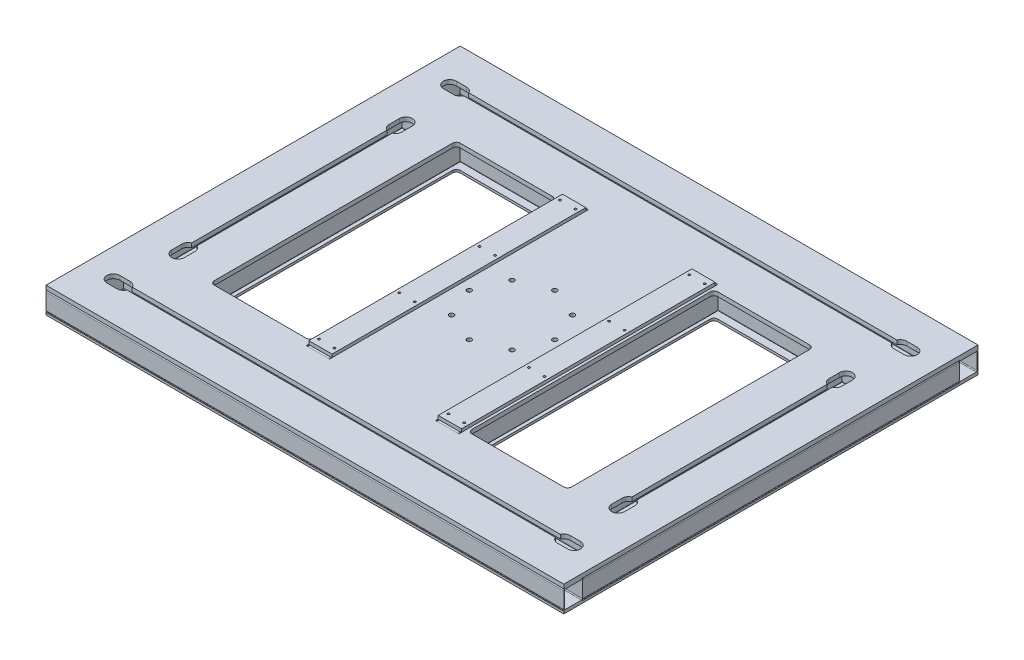
from build123d import *

# Parameters (mm, degrees)
SKETCH_1_W               = 2000
SKETCH_1_H               = 1600
EXTRUDE_1_DEPTH          = 9
CUT_EXTRUDE_1_DEPTH      = 1281.656472283
CUT_EXTRUDE_1_DEPTH_BACK = 1281.656472283
CUT_EXTRUDE_2_DEPTH      = 1281.656472283
CUT_EXTRUDE_2_DEPTH_BACK = 1281.656472283
CUT_EXTRUDE_3_DEPTH      = 1281.656472283
CUT_EXTRUDE_3_DEPTH_BACK = 1281.656472283
EXTRUDE_2_DEPTH          = 1000
EXTRUDE_2_DEPTH_BACK     = 1000
EXTRUDE_3_DEPTH          = 925
EXTRUDE_3_DEPTH_BACK     = 925
EXTRUDE_4_DEPTH          = 725
EXTRUDE_4_DEPTH_BACK     = 725
EXTRUDE_5_DEPTH          = 500
EXTRUDE_5_DEPTH_BACK     = 500
SKETCH_10_W              = 2000
SKETCH_10_H              = 1600
EXTRUDE_6_DEPTH          = 16
CUT_EXTRUDE_4_DEPTH      = 1285.523257867
CUT_EXTRUDE_4_DEPTH_BACK = 1285.523257867
SKETCH_13_W              = 90
SKETCH_13_H              = 1000
CUT_EXTRUDE_5_DEPTH      = 16
EXTRUDE_7_DEPTH          = 500
EXTRUDE_7_DEPTH_BACK     = 500
SKETCH_16_W              = 90
SKETCH_16_H              = 980
EXTRUDE_8_DEPTH          = 13
SKETCH_17_W              = 90
SKETCH_17_H              = 980
EXTRUDE_9_DEPTH          = 13
CUT_EXTRUDE_6_DEPTH      = 16
CUT_EXTRUDE_7_DEPTH      = 16
CUT_EXTRUDE_8_DEPTH      = 1286.513127121
CUT_EXTRUDE_8_DEPTH_BACK = 1286.513127121
SKETCH_20_R              = 9
SKETCH_22_R              = 4.188
CUT_EXTRUDE_9_DEPTH      = 15.3


with BuildPart() as part:
    # ｽｹｯﾁ1 → ﾎﾞｽ - 押し出し1 (new body)
    with BuildSketch(Plane(origin=(0, 0, 0), x_dir=(1, 0, 0), z_dir=(0, 1, 0))):
        Rectangle(SKETCH_1_W, SKETCH_1_H)
    extrude(amount=EXTRUDE_1_DEPTH)

    # ｽｹｯﾁ2 → ｶｯﾄ - 押し出し1 (cut, two sides: drawn at the far end of the back side and taken through both)
    with BuildSketch(Plane(origin=(0, 0, 0), x_dir=(1, 0, 0), z_dir=(0, 1, 0)).offset(-CUT_EXTRUDE_1_DEPTH_BACK)):
        with BuildLine():
            Line((-675, -475), (-320, -475))
            ThreePointArc((-320, -475), (-309.393398282, -470.606601718), (-305, -460))
            Line((-305, -460), (-305, 460))
            ThreePointArc((-305, 460), (-309.393398282, 470.606601718), (-320, 475))
            Line((-320, 475), (-675, 475))
            ThreePointArc((-675, 475), (-685.606601718, 470.606601718), (-690, 460))
            Line((-690, 460), (-690, -460))
            ThreePointArc((-690, -460), (-685.606601718, -470.606601718), (-675, -475))
        make_face()
        with BuildLine():
            Line((320, -475), (675, -475))
            ThreePointArc((675, -475), (685.606601718, -470.606601718), (690, -460))
            Line((690, -460), (690, 460))
            ThreePointArc((690, 460), (685.606601718, 470.606601718), (675, 475))
            Line((675, 475), (320, 475))
            ThreePointArc((320, 475), (309.393398282, 470.606601718), (305, 460))
            Line((305, 460), (305, -460))
            ThreePointArc((305, -460), (309.393398282, -470.606601718), (320, -475))
        make_face()
    extrude(amount=CUT_EXTRUDE_1_DEPTH + CUT_EXTRUDE_1_DEPTH_BACK, mode=Mode.SUBTRACT)

    # ｽｹｯﾁ3 → ｶｯﾄ - 押し出し2 (cut, two sides: drawn at the far end of the back side and taken through both)
    with BuildSketch(Plane(origin=(0, 0, 0), x_dir=(1, 0, 0), z_dir=(0, 1, 0)).offset(-CUT_EXTRUDE_2_DEPTH_BACK)):
        with BuildLine():
            Line((-885, -475), (-815, -475))
            ThreePointArc((-815, -475), (-804.393398282, -470.606601718), (-800, -460))
            Line((-800, -460), (-800, 460))
            ThreePointArc((-800, 460), (-804.393398282, 470.606601718), (-815, 475))
            Line((-815, 475), (-885, 475))
            ThreePointArc((-885, 475), (-895.606601718, 470.606601718), (-900, 460))
            Line((-900, 460), (-900, -460))
            ThreePointArc((-900, -460), (-895.606601718, -470.606601718), (-885, -475))
        make_face()
        with BuildLine():
            Line((815, -475), (885, -475))
            ThreePointArc((885, -475), (895.606601718, -470.606601718), (900, -460))
            Line((900, -460), (900, 460))
            ThreePointArc((900, 460), (895.606601718, 470.606601718), (885, 475))
            Line((885, 475), (815, 475))
            ThreePointArc((815, 475), (804.393398282, 470.606601718), (800, 460))
            Line((800, 460), (800, -460))
            ThreePointArc((800, -460), (804.393398282, -470.606601718), (815, -475))
        make_face()
    extrude(amount=CUT_EXTRUDE_2_DEPTH + CUT_EXTRUDE_2_DEPTH_BACK, mode=Mode.SUBTRACT)

    # ｽｹｯﾁ4 → ｶｯﾄ - 押し出し3 (cut, two sides: drawn at the far end of the back side and taken through both)
    with BuildSketch(Plane(origin=(0, 0, 0), x_dir=(1, 0, 0), z_dir=(0, 1, 0)).offset(-CUT_EXTRUDE_3_DEPTH_BACK)):
        with BuildLine():
            Line((-885, -700), (885, -700))
            ThreePointArc((885, -700), (895.606601718, -695.606601718), (900, -685))
            Line((900, -685), (900, -615))
            ThreePointArc((900, -615), (895.606601718, -604.393398282), (885, -600))
            Line((885, -600), (-885, -600))
            ThreePointArc((-885, -600), (-895.606601718, -604.393398282), (-900, -615))
            Line((-900, -615), (-900, -685))
            ThreePointArc((-900, -685), (-895.606601718, -695.606601718), (-885, -700))
        make_face()
        with BuildLine():
            Line((-885, 600), (885, 600))
            ThreePointArc((885, 600), (895.606601718, 604.393398282), (900, 615))
            Line((900, 615), (900, 685))
            ThreePointArc((900, 685), (895.606601718, 695.606601718), (885, 700))
            Line((885, 700), (-885, 700))
            ThreePointArc((-885, 700), (-895.606601718, 695.606601718), (-900, 685))
            Line((-900, 685), (-900, 615))
            ThreePointArc((-900, 615), (-895.606601718, 604.393398282), (-885, 600))
        make_face()
    extrude(amount=CUT_EXTRUDE_3_DEPTH + CUT_EXTRUDE_3_DEPTH_BACK, mode=Mode.SUBTRACT)

    # ｽｹｯﾁ5 → ﾎﾞｽ - 押し出し2 (add, two sides: drawn at the far end of the back side and taken through both)
    # profile 1 of 2: a face of its own
    with BuildSketch(Plane(origin=(0, 0, 0), x_dir=(0, 0, -1), z_dir=(1, 0, 0)).offset(-EXTRUDE_2_DEPTH_BACK)):
        with BuildLine():
            Line((-793.6, 9), (-731.4, 9))
            ThreePointArc((-731.4, 9), (-726.8745166, 10.8745166), (-725, 15.4))
            Line((-725, 15.4), (-725, 77.6))
            ThreePointArc((-725, 77.6), (-726.8745166, 82.1254834), (-731.4, 84))
            Line((-731.4, 84), (-793.6, 84))
            ThreePointArc((-793.6, 84), (-798.1254834, 82.1254834), (-800, 77.6))
            Line((-800, 77.6), (-800, 15.4))
            ThreePointArc((-800, 15.4), (-798.1254834, 10.8745166), (-793.6, 9))
        make_face()
        with BuildLine():
            Line((-793.6, 12.2), (-731.4, 12.2))
            ThreePointArc((-731.4, 12.2), (-729.1372583, 13.1372583), (-728.2, 15.4))
            Line((-728.2, 15.4), (-728.2, 77.6))
            ThreePointArc((-728.2, 77.6), (-729.1372583, 79.8627417), (-731.4, 80.8))
            Line((-731.4, 80.8), (-793.6, 80.8))
            ThreePointArc((-793.6, 80.8), (-795.8627417, 79.8627417), (-796.8, 77.6))
            Line((-796.8, 77.6), (-796.8, 15.4))
            ThreePointArc((-796.8, 15.4), (-795.8627417, 13.1372583), (-793.6, 12.2))
        make_face(mode=Mode.SUBTRACT)
    # profile 2 of 2: a face of its own
    with BuildSketch(Plane(origin=(0, 0, 0), x_dir=(0, 0, -1), z_dir=(1, 0, 0)).offset(-EXTRUDE_2_DEPTH_BACK)):
        with BuildLine():
            Line((731.4, 9), (793.6, 9))
            ThreePointArc((793.6, 9), (798.1254834, 10.8745166), (800, 15.4))
            Line((800, 15.4), (800, 77.6))
            ThreePointArc((800, 77.6), (798.1254834, 82.1254834), (793.6, 84))
            Line((793.6, 84), (731.4, 84))
            ThreePointArc((731.4, 84), (726.8745166, 82.1254834), (725, 77.6))
            Line((725, 77.6), (725, 15.4))
            ThreePointArc((725, 15.4), (726.8745166, 10.8745166), (731.4, 9))
        make_face()
        with BuildLine():
            Line((731.4, 12.2), (793.6, 12.2))
            ThreePointArc((793.6, 12.2), (795.8627417, 13.1372583), (796.8, 15.4))
            Line((796.8, 15.4), (796.8, 77.6))
            ThreePointArc((796.8, 77.6), (795.8627417, 79.8627417), (793.6, 80.8))
            Line((793.6, 80.8), (731.4, 80.8))
            ThreePointArc((731.4, 80.8), (729.1372583, 79.8627417), (728.2, 77.6))
            Line((728.2, 77.6), (728.2, 15.4))
            ThreePointArc((728.2, 15.4), (729.1372583, 13.1372583), (731.4, 12.2))
        make_face(mode=Mode.SUBTRACT)
    extrude(amount=EXTRUDE_2_DEPTH + EXTRUDE_2_DEPTH_BACK)

    # ｽｹｯﾁ6 → ﾎﾞｽ - 押し出し3 (add, two sides: drawn at the far end of the back side and taken through both)
    # profile 1 of 2: a face of its own
    with BuildSketch(Plane(origin=(0, 0, 0), x_dir=(0, 0, -1), z_dir=(1, 0, 0)).offset(-EXTRUDE_3_DEPTH_BACK)):
        with BuildLine():
            Line((-568.6, 9), (-506.4, 9))
            ThreePointArc((-506.4, 9), (-501.8745166, 10.8745166), (-500, 15.4))
            Line((-500, 15.4), (-500, 77.6))
            ThreePointArc((-500, 77.6), (-501.8745166, 82.1254834), (-506.4, 84))
            Line((-506.4, 84), (-568.6, 84))
            ThreePointArc((-568.6, 84), (-573.1254834, 82.1254834), (-575, 77.6))
            Line((-575, 77.6), (-575, 15.4))
            ThreePointArc((-575, 15.4), (-573.1254834, 10.8745166), (-568.6, 9))
        make_face()
        with BuildLine():
            Line((-568.6, 12.2), (-506.4, 12.2))
            ThreePointArc((-506.4, 12.2), (-504.1372583, 13.1372583), (-503.2, 15.4))
            Line((-503.2, 15.4), (-503.2, 77.6))
            ThreePointArc((-503.2, 77.6), (-504.1372583, 79.8627417), (-506.4, 80.8))
            Line((-506.4, 80.8), (-568.6, 80.8))
            ThreePointArc((-568.6, 80.8), (-570.8627417, 79.8627417), (-571.8, 77.6))
            Line((-571.8, 77.6), (-571.8, 15.4))
            ThreePointArc((-571.8, 15.4), (-570.8627417, 13.1372583), (-568.6, 12.2))
        make_face(mode=Mode.SUBTRACT)
    # profile 2 of 2: a face of its own
    with BuildSketch(Plane(origin=(0, 0, 0), x_dir=(0, 0, -1), z_dir=(1, 0, 0)).offset(-EXTRUDE_3_DEPTH_BACK)):
        with BuildLine():
            Line((506.4, 9), (568.6, 9))
            ThreePointArc((568.6, 9), (573.1254834, 10.8745166), (575, 15.4))
            Line((575, 15.4), (575, 77.6))
            ThreePointArc((575, 77.6), (573.1254834, 82.1254834), (568.6, 84))
            Line((568.6, 84), (506.4, 84))
            ThreePointArc((506.4, 84), (501.8745166, 82.1254834), (500, 77.6))
            Line((500, 77.6), (500, 15.4))
            ThreePointArc((500, 15.4), (501.8745166, 10.8745166), (506.4, 9))
        make_face()
        with BuildLine():
            Line((506.4, 12.2), (568.6, 12.2))
            ThreePointArc((568.6, 12.2), (570.8627417, 13.1372583), (571.8, 15.4))
            Line((571.8, 15.4), (571.8, 77.6))
            ThreePointArc((571.8, 77.6), (570.8627417, 79.8627417), (568.6, 80.8))
            Line((568.6, 80.8), (506.4, 80.8))
            ThreePointArc((506.4, 80.8), (504.1372583, 79.8627417), (503.2, 77.6))
            Line((503.2, 77.6), (503.2, 15.4))
            ThreePointArc((503.2, 15.4), (504.1372583, 13.1372583), (506.4, 12.2))
        make_face(mode=Mode.SUBTRACT)
    extrude(amount=EXTRUDE_3_DEPTH + EXTRUDE_3_DEPTH_BACK)

    # ｽｹｯﾁ7 → ﾎﾞｽ - 押し出し4 (add, two sides: drawn at the far end of the back side and taken through both)
    # profile 1 of 2: a face of its own
    with BuildSketch(Plane.XY.offset(-EXTRUDE_4_DEPTH_BACK)):
        with BuildLine():
            Line((-993.6, 9), (-931.4, 9))
            ThreePointArc((-931.4, 9), (-926.8745166, 10.8745166), (-925, 15.4))
            Line((-925, 15.4), (-925, 77.6))
            ThreePointArc((-925, 77.6), (-926.8745166, 82.1254834), (-931.4, 84))
            Line((-931.4, 84), (-993.6, 84))
            ThreePointArc((-993.6, 84), (-998.1254834, 82.1254834), (-1000, 77.6))
            Line((-1000, 77.6), (-1000, 15.4))
            ThreePointArc((-1000, 15.4), (-998.1254834, 10.8745166), (-993.6, 9))
        make_face()
        with BuildLine():
            Line((-993.6, 12.2), (-931.4, 12.2))
            ThreePointArc((-931.4, 12.2), (-929.1372583, 13.1372583), (-928.2, 15.4))
            Line((-928.2, 15.4), (-928.2, 77.6))
            ThreePointArc((-928.2, 77.6), (-929.1372583, 79.8627417), (-931.4, 80.8))
            Line((-931.4, 80.8), (-993.6, 80.8))
            ThreePointArc((-993.6, 80.8), (-995.8627417, 79.8627417), (-996.8, 77.6))
            Line((-996.8, 77.6), (-996.8, 15.4))
            ThreePointArc((-996.8, 15.4), (-995.8627417, 13.1372583), (-993.6, 12.2))
        make_face(mode=Mode.SUBTRACT)
    # profile 2 of 2: a face of its own
    with BuildSketch(Plane.XY.offset(-EXTRUDE_4_DEPTH_BACK)):
        with BuildLine():
            Line((931.4, 9), (993.6, 9))
            ThreePointArc((993.6, 9), (998.1254834, 10.8745166), (1000, 15.4))
            Line((1000, 15.4), (1000, 77.6))
            ThreePointArc((1000, 77.6), (998.1254834, 82.1254834), (993.6, 84))
            Line((993.6, 84), (931.4, 84))
            ThreePointArc((931.4, 84), (926.8745166, 82.1254834), (925, 77.6))
            Line((925, 77.6), (925, 15.4))
            ThreePointArc((925, 15.4), (926.8745166, 10.8745166), (931.4, 9))
        make_face()
        with BuildLine():
            Line((931.4, 12.2), (993.6, 12.2))
            ThreePointArc((993.6, 12.2), (995.8627417, 13.1372583), (996.8, 15.4))
            Line((996.8, 15.4), (996.8, 77.6))
            ThreePointArc((996.8, 77.6), (995.8627417, 79.8627417), (993.6, 80.8))
            Line((993.6, 80.8), (931.4, 80.8))
            ThreePointArc((931.4, 80.8), (929.1372583, 79.8627417), (928.2, 77.6))
            Line((928.2, 77.6), (928.2, 15.4))
            ThreePointArc((928.2, 15.4), (929.1372583, 13.1372583), (931.4, 12.2))
        make_face(mode=Mode.SUBTRACT)
    extrude(amount=EXTRUDE_4_DEPTH + EXTRUDE_4_DEPTH_BACK)

    # ｽｹｯﾁ8 → ﾎﾞｽ - 押し出し5 (add, two sides: drawn at the far end of the back side and taken through both)
    # profile 1 of 2: a face of its own
    with BuildSketch(Plane.XY.offset(-EXTRUDE_5_DEPTH_BACK)):
        with BuildLine():
            Line((-768.6, 9), (-706.4, 9))
            ThreePointArc((-706.4, 9), (-701.8745166, 10.8745166), (-700, 15.4))
            Line((-700, 15.4), (-700, 77.6))
            ThreePointArc((-700, 77.6), (-701.8745166, 82.1254834), (-706.4, 84))
            Line((-706.4, 84), (-768.6, 84))
            ThreePointArc((-768.6, 84), (-773.1254834, 82.1254834), (-775, 77.6))
            Line((-775, 77.6), (-775, 15.4))
            ThreePointArc((-775, 15.4), (-773.1254834, 10.8745166), (-768.6, 9))
        make_face()
        with BuildLine():
            Line((-768.6, 12.2), (-706.4, 12.2))
            ThreePointArc((-706.4, 12.2), (-704.1372583, 13.1372583), (-703.2, 15.4))
            Line((-703.2, 15.4), (-703.2, 77.6))
            ThreePointArc((-703.2, 77.6), (-704.1372583, 79.8627417), (-706.4, 80.8))
            Line((-706.4, 80.8), (-768.6, 80.8))
            ThreePointArc((-768.6, 80.8), (-770.8627417, 79.8627417), (-771.8, 77.6))
            Line((-771.8, 77.6), (-771.8, 15.4))
            ThreePointArc((-771.8, 15.4), (-770.8627417, 13.1372583), (-768.6, 12.2))
        make_face(mode=Mode.SUBTRACT)
    # profile 2 of 2: a face of its own
    with BuildSketch(Plane.XY.offset(-EXTRUDE_5_DEPTH_BACK)):
        with BuildLine():
            Line((706.4, 9), (768.6, 9))
            ThreePointArc((768.6, 9), (773.1254834, 10.8745166), (775, 15.4))
            Line((775, 15.4), (775, 77.6))
            ThreePointArc((775, 77.6), (773.1254834, 82.1254834), (768.6, 84))
            Line((768.6, 84), (706.4, 84))
            ThreePointArc((706.4, 84), (701.8745166, 82.1254834), (700, 77.6))
            Line((700, 77.6), (700, 15.4))
            ThreePointArc((700, 15.4), (701.8745166, 10.8745166), (706.4, 9))
        make_face()
        with BuildLine():
            Line((706.4, 12.2), (768.6, 12.2))
            ThreePointArc((768.6, 12.2), (770.8627417, 13.1372583), (771.8, 15.4))
            Line((771.8, 15.4), (771.8, 77.6))
            ThreePointArc((771.8, 77.6), (770.8627417, 79.8627417), (768.6, 80.8))
            Line((768.6, 80.8), (706.4, 80.8))
            ThreePointArc((706.4, 80.8), (704.1372583, 79.8627417), (703.2, 77.6))
            Line((703.2, 77.6), (703.2, 15.4))
            ThreePointArc((703.2, 15.4), (704.1372583, 13.1372583), (706.4, 12.2))
        make_face(mode=Mode.SUBTRACT)
    extrude(amount=EXTRUDE_5_DEPTH + EXTRUDE_5_DEPTH_BACK)

    # ｽｹｯﾁ10 → ﾎﾞｽ - 押し出し6 (add)
    with BuildSketch(Plane(origin=(0, 84, 0), x_dir=(1, 0, 0), z_dir=(0, 1, 0))):
        Rectangle(SKETCH_10_W, SKETCH_10_H)
    extrude(amount=EXTRUDE_6_DEPTH)

    # ｽｹｯﾁ11 → ｶｯﾄ - 押し出し4 (cut, two sides: drawn at the far end of the back side and taken through both)
    with BuildSketch(Plane(origin=(0, 0, 0), x_dir=(1, 0, 0), z_dir=(0, 1, 0)).offset(-CUT_EXTRUDE_4_DEPTH_BACK)):
        with BuildLine():
            Line((-675, -475), (-320, -475))
            ThreePointArc((-320, -475), (-309.393398282, -470.606601718), (-305, -460))
            Line((-305, -460), (-305, 460))
            ThreePointArc((-305, 460), (-309.393398282, 470.606601718), (-320, 475))
            Line((-320, 475), (-675, 475))
            ThreePointArc((-675, 475), (-685.606601718, 470.606601718), (-690, 460))
            Line((-690, 460), (-690, -460))
            ThreePointArc((-690, -460), (-685.606601718, -470.606601718), (-675, -475))
        make_face()
        with BuildLine():
            Line((320, -475), (675, -475))
            ThreePointArc((675, -475), (685.606601718, -470.606601718), (690, -460))
            Line((690, -460), (690, 460))
            ThreePointArc((690, 460), (685.606601718, 470.606601718), (675, 475))
            Line((675, 475), (320, 475))
            ThreePointArc((320, 475), (309.393398282, 470.606601718), (305, 460))
            Line((305, 460), (305, -460))
            ThreePointArc((305, -460), (309.393398282, -470.606601718), (320, -475))
        make_face()
    extrude(amount=CUT_EXTRUDE_4_DEPTH + CUT_EXTRUDE_4_DEPTH_BACK, mode=Mode.SUBTRACT)

    # ｽｹｯﾁ13 → ｶｯﾄ - 押し出し5 (cut)
    with BuildSketch(Plane(origin=(0, 100, 0), x_dir=(1, 0, 0), z_dir=(0, 1, 0))):
        with Locations((-250, 0)):
            Rectangle(SKETCH_13_W, SKETCH_13_H)
        with Locations((250, 0)):
            Rectangle(SKETCH_13_W, SKETCH_13_H)
    extrude(amount=-CUT_EXTRUDE_5_DEPTH, mode=Mode.SUBTRACT)

    # ｽｹｯﾁ14 → ﾎﾞｽ - 押し出し7 (add, two sides: drawn at the far end of the back side and taken through both)
    # profile 1 of 2: a face of its own
    with BuildSketch(Plane.XY.offset(-EXTRUDE_7_DEPTH_BACK)):
        with BuildLine():
            Line((-290.4, 9), (-209.6, 9))
            ThreePointArc((-209.6, 9), (-206.347308807, 10.347308807), (-205, 13.6))
            Line((-205, 13.6), (-205, 94.4))
            ThreePointArc((-205, 94.4), (-206.347308807, 97.652691193), (-209.6, 99))
            Line((-209.6, 99), (-290.4, 99))
            ThreePointArc((-290.4, 99), (-293.652691193, 97.652691193), (-295, 94.4))
            Line((-295, 94.4), (-295, 13.6))
            ThreePointArc((-295, 13.6), (-293.652691193, 10.347308807), (-290.4, 9))
        make_face()
        with BuildLine():
            Line((-290.4, 11.3), (-209.6, 11.3))
            ThreePointArc((-209.6, 11.3), (-207.973654403, 11.973654403), (-207.3, 13.6))
            Line((-207.3, 13.6), (-207.3, 94.4))
            ThreePointArc((-207.3, 94.4), (-207.973654403, 96.026345597), (-209.6, 96.7))
            Line((-209.6, 96.7), (-290.4, 96.7))
            ThreePointArc((-290.4, 96.7), (-292.026345597, 96.026345597), (-292.7, 94.4))
            Line((-292.7, 94.4), (-292.7, 13.6))
            ThreePointArc((-292.7, 13.6), (-292.026345597, 11.973654403), (-290.4, 11.3))
        make_face(mode=Mode.SUBTRACT)
    # profile 2 of 2: a face of its own
    with BuildSketch(Plane.XY.offset(-EXTRUDE_7_DEPTH_BACK)):
        with BuildLine():
            Line((209.6, 9), (290.4, 9))
            ThreePointArc((290.4, 9), (293.652691193, 10.347308807), (295, 13.6))
            Line((295, 13.6), (295, 94.4))
            ThreePointArc((295, 94.4), (293.652691193, 97.652691193), (290.4, 99))
            Line((290.4, 99), (209.6, 99))
            ThreePointArc((209.6, 99), (206.347308807, 97.652691193), (205, 94.4))
            Line((205, 94.4), (205, 13.6))
            ThreePointArc((205, 13.6), (206.347308807, 10.347308807), (209.6, 9))
        make_face()
        with BuildLine():
            Line((209.6, 11.3), (290.4, 11.3))
            ThreePointArc((290.4, 11.3), (292.026345597, 11.973654403), (292.7, 13.6))
            Line((292.7, 13.6), (292.7, 94.4))
            ThreePointArc((292.7, 94.4), (292.026345597, 96.026345597), (290.4, 96.7))
            Line((290.4, 96.7), (209.6, 96.7))
            ThreePointArc((209.6, 96.7), (207.973654403, 96.026345597), (207.3, 94.4))
            Line((207.3, 94.4), (207.3, 13.6))
            ThreePointArc((207.3, 13.6), (207.973654403, 11.973654403), (209.6, 11.3))
        make_face(mode=Mode.SUBTRACT)
    extrude(amount=EXTRUDE_7_DEPTH + EXTRUDE_7_DEPTH_BACK)

    # ｽｹｯﾁ16 → ﾎﾞｽ - 押し出し8 (add)
    with BuildSketch(Plane(origin=(0, 99, 0), x_dir=(1, 0, 0), z_dir=(0, 1, 0))):
        with Locations((-250, 0)):
            Rectangle(SKETCH_16_W, SKETCH_16_H)
    extrude(amount=EXTRUDE_8_DEPTH)

    # ｽｹｯﾁ17 → ﾎﾞｽ - 押し出し9 (add)
    with BuildSketch(Plane(origin=(0, 99, 0), x_dir=(1, 0, 0), z_dir=(0, 1, 0))):
        with Locations((250, 0)):
            Rectangle(SKETCH_17_W, SKETCH_17_H)
    extrude(amount=EXTRUDE_9_DEPTH)

    # ｽｹｯﾁ18 → ｶｯﾄ - 押し出し6 (cut)
    with BuildSketch(Plane(origin=(0, 100, 0), x_dir=(1, 0, 0), z_dir=(0, 1, 0))):
        with BuildLine():
            Line((-890, -675), (-850, -675))
            ThreePointArc((-850, -675), (-836.306936062, -670.916500663), (-827.087121525, -660))
            Line((-827.087121525, -660), (827.087121525, -660))
            ThreePointArc((827.087121525, -660), (836.306936062, -670.916500663), (850, -675))
            Line((850, -675), (890, -675))
            ThreePointArc((890, -675), (907.67766953, -667.67766953), (915, -650))
            ThreePointArc((915, -650), (907.67766953, -632.32233047), (890, -625))
            Line((890, -625), (850, -625))
            ThreePointArc((850, -625), (836.306936062, -629.083499337), (827.087121525, -640))
            Line((827.087121525, -640), (-827.087121525, -640))
            ThreePointArc((-827.087121525, -640), (-836.306936062, -629.083499337), (-850, -625))
            Line((-850, -625), (-890, -625))
            ThreePointArc((-890, -625), (-907.67766953, -632.32233047), (-915, -650))
            ThreePointArc((-915, -650), (-907.67766953, -667.67766953), (-890, -675))
        make_face()
        with BuildLine():
            Line((-890, 625), (-850, 625))
            ThreePointArc((-850, 625), (-836.306936062, 629.083499337), (-827.087121525, 640))
            Line((-827.087121525, 640), (827.087121525, 640))
            ThreePointArc((827.087121525, 640), (836.306936062, 629.083499337), (850, 625))
            Line((850, 625), (890, 625))
            ThreePointArc((890, 625), (907.67766953, 632.32233047), (915, 650))
            ThreePointArc((915, 650), (907.67766953, 667.67766953), (890, 675))
            Line((890, 675), (850, 675))
            ThreePointArc((850, 675), (836.306936062, 670.916500663), (827.087121525, 660))
            Line((827.087121525, 660), (-827.087121525, 660))
            ThreePointArc((-827.087121525, 660), (-836.306936062, 670.916500663), (-850, 675))
            Line((-850, 675), (-890, 675))
            ThreePointArc((-890, 675), (-907.67766953, 667.67766953), (-915, 650))
            ThreePointArc((-915, 650), (-907.67766953, 632.32233047), (-890, 625))
        make_face()
    extrude(amount=-CUT_EXTRUDE_6_DEPTH, mode=Mode.SUBTRACT)

    # ｽｹｯﾁ19 → ｶｯﾄ - 押し出し7 (cut)
    with BuildSketch(Plane(origin=(0, 100, 0), x_dir=(1, 0, 0), z_dir=(0, 1, 0))):
        with BuildLine():
            Line((-875, -440), (-875, -400))
            ThreePointArc((-875, -400), (-870.916500663, -386.306936062), (-860, -377.087121525))
            Line((-860, -377.087121525), (-860, 377.087121525))
            ThreePointArc((-860, 377.087121525), (-870.916500663, 386.306936062), (-875, 400))
            Line((-875, 400), (-875, 440))
            ThreePointArc((-875, 440), (-867.67766953, 457.67766953), (-850, 465))
            ThreePointArc((-850, 465), (-832.32233047, 457.67766953), (-825, 440))
            Line((-825, 440), (-825, 400))
            ThreePointArc((-825, 400), (-829.083499337, 386.306936062), (-840, 377.087121525))
            Line((-840, 377.087121525), (-840, -377.087121525))
            ThreePointArc((-840, -377.087121525), (-829.083499337, -386.306936062), (-825, -400))
            Line((-825, -400), (-825, -440))
            ThreePointArc((-825, -440), (-832.32233047, -457.67766953), (-850, -465))
            ThreePointArc((-850, -465), (-867.67766953, -457.67766953), (-875, -440))
        make_face()
        with BuildLine():
            Line((825, -440), (825, -400))
            ThreePointArc((825, -400), (829.083499337, -386.306936062), (840, -377.087121525))
            Line((840, -377.087121525), (840, 377.087121525))
            ThreePointArc((840, 377.087121525), (829.083499337, 386.306936062), (825, 400))
            Line((825, 400), (825, 440))
            ThreePointArc((825, 440), (832.32233047, 457.67766953), (850, 465))
            ThreePointArc((850, 465), (867.67766953, 457.67766953), (875, 440))
            Line((875, 440), (875, 400))
            ThreePointArc((875, 400), (870.916500663, 386.306936062), (860, 377.087121525))
            Line((860, 377.087121525), (860, -377.087121525))
            ThreePointArc((860, -377.087121525), (870.916500663, -386.306936062), (875, -400))
            Line((875, -400), (875, -440))
            ThreePointArc((875, -440), (867.67766953, -457.67766953), (850, -465))
            ThreePointArc((850, -465), (832.32233047, -457.67766953), (825, -440))
        make_face()
    extrude(amount=-CUT_EXTRUDE_7_DEPTH, mode=Mode.SUBTRACT)

    # ｽｹｯﾁ20 → ｶｯﾄ - 押し出し8 (cut, two sides: drawn at the far end of the back side and taken through both)
    with BuildSketch(Plane(origin=(0, 0, 0), x_dir=(1, 0, 0), z_dir=(0, 1, 0)).offset(-CUT_EXTRUDE_8_DEPTH_BACK)):
        with Locations((165, 0)):
            Circle(SKETCH_20_R)
        with Locations((116.672618896, 116.672618896)):
            Circle(SKETCH_20_R)
        with Locations((0, 165)):
            Circle(SKETCH_20_R)
        with Locations((-116.672618896, 116.672618896)):
            Circle(SKETCH_20_R)
        with Locations((-165, 0)):
            Circle(SKETCH_20_R)
        with Locations((-116.672618896, -116.672618896)):
            Circle(SKETCH_20_R)
        with Locations((0, -165)):
            Circle(SKETCH_20_R)
        with Locations((116.672618896, -116.672618896)):
            Circle(SKETCH_20_R)
    extrude(amount=CUT_EXTRUDE_8_DEPTH + CUT_EXTRUDE_8_DEPTH_BACK, mode=Mode.SUBTRACT)

    # ｽｹｯﾁ22 → ｶｯﾄ - 押し出し9 (cut)
    with BuildSketch(Plane(origin=(0, 112, 0), x_dir=(1, 0, 0), z_dir=(0, 1, 0))):
        with Locations((-220, -155)):
            Circle(SKETCH_22_R)
        with Locations((-220, -465)):
            Circle(SKETCH_22_R)
        with Locations((-220, 155)):
            Circle(SKETCH_22_R)
        with Locations((-220, 465)):
            Circle(SKETCH_22_R)
        with Locations((-280, -155)):
            Circle(SKETCH_22_R)
        with Locations((-280, -465)):
            Circle(SKETCH_22_R)
        with Locations((-280, 155)):
            Circle(SKETCH_22_R)
        with Locations((-280, 465)):
            Circle(SKETCH_22_R)
        with Locations((220, -155)):
            Circle(SKETCH_22_R)
        with Locations((220, -465)):
            Circle(SKETCH_22_R)
        with Locations((220, 155)):
            Circle(SKETCH_22_R)
        with Locations((220, 465)):
            Circle(SKETCH_22_R)
        with Locations((280, -155)):
            Circle(SKETCH_22_R)
        with Locations((280, -465)):
            Circle(SKETCH_22_R)
        with Locations((280, 155)):
            Circle(SKETCH_22_R)
        with Locations((280, 465)):
            Circle(SKETCH_22_R)
    extrude(amount=-CUT_EXTRUDE_9_DEPTH, mode=Mode.SUBTRACT)


solid = part.part
